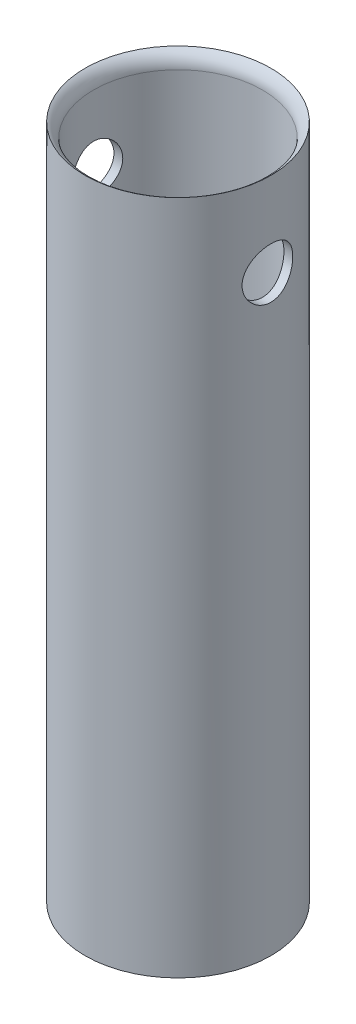
from build123d import *

# Parameters (mm, degrees)
SKETCH1_R               = 5.5
SKETCH1_R_2             = 4.999999999999999
BOSS_EXTRUDE1_DEPTH     = 40
FILLET1_R               = 1
FILLET2_R               = 1
CUT_EXTRUDE1_DEPTH      = 41.74923312161882
CUT_EXTRUDE1_DEPTH_BACK = 41.74923312161882
SKETCH2_R               = 1.5000000000000004


with BuildPart() as part:
    # Sketch1 → Boss-Extrude1 (new body)
    with BuildSketch(Plane(origin=(0, 0, 0), x_dir=(1, 0, 0), z_dir=(0, 1, 0))):
        with Locations(Location((0, 0, 0), (0, 0, 270))):
            Circle(SKETCH1_R)
        with Locations(Location((0, 0, 0), (0, 0, 270))):
            Circle(SKETCH1_R_2, mode=Mode.SUBTRACT)
    extrude(amount=BOSS_EXTRUDE1_DEPTH)

    # Fillet1
    # the kernel refuses this fillet: 1 mm, written as the material it takes off along each edge
    with BuildSketch(Plane(origin=(0, 40, 0), x_dir=(-1.8e-16, 0, 1), z_dir=(-1, 0, -1.8e-16))) as fillet1_piece_1:
        with BuildLine():
            CenterArc((5.999999999999999, -0.8660254037844908), FILLET1_R, 119.9999999999984, 60.00000000000159)
            Line((5.500000000000022, -3.553e-14), (5.490000000000022, 0.01732050807565599))
            ThreePointArc((5.490000000000022, 0.01732050807565599), (5.250000000000011, 0.02000000000000313), (4.999999999999999, 0.02000000000000313))
            Line((4.999999999999999, 0.02000000000000313), (4.9799999999999995, 0))
            Line((4.9799999999999995, 0), (4.9799999999999995, -0.8660254037844908))
            Line((4.9799999999999995, -0.8660254037844908), (4.999999999999999, -0.8660254037844908))
        make_face()
    revolve(axis=Axis((0, 40, 0), (0, 1, 0)), mode=Mode.SUBTRACT)

    # Fillet2
    # the kernel refuses this fillet: 1 mm, written as the material it takes off along each edge
    with BuildSketch(Plane(origin=(0, 0, 0), x_dir=(-1.8e-16, 0, 1), z_dir=(-1, 0, -1.8e-16))) as fillet2_piece_1:
        with BuildLine():
            CenterArc((5.999999999999999, 0.866025403784488), FILLET2_R, 180, 60.00000000000148)
            Line((4.999999999999999, 0.866025403784488), (4.9799999999999995, 0.866025403784488))
            Line((4.9799999999999995, 0.866025403784488), (4.9799999999999995, 0))
            Line((4.9799999999999995, 0), (4.999999999999999, -0.02))
            ThreePointArc((4.999999999999999, -0.02), (5.250000000000011, -0.02), (5.4900000000000215, -0.0173205080756525))
            Line((5.4900000000000215, -0.0173205080756525), (5.500000000000021, 3.653e-14))
        make_face()
    revolve(axis=Axis((0, 0, 0), (0, 1, 0)), mode=Mode.SUBTRACT)

    # Sketch2 → Cut-Extrude1 (cut, two sides: drawn at the far end of the back side and taken through both)
    with BuildSketch(Plane(origin=(0, 0, 0), x_dir=(0, 0, -1), z_dir=(1, 0, 0)).offset(-CUT_EXTRUDE1_DEPTH_BACK)):
        with Locations((0, 35)):
            Circle(SKETCH2_R)
    extrude(amount=CUT_EXTRUDE1_DEPTH + CUT_EXTRUDE1_DEPTH_BACK, mode=Mode.SUBTRACT)


solid = part.part
